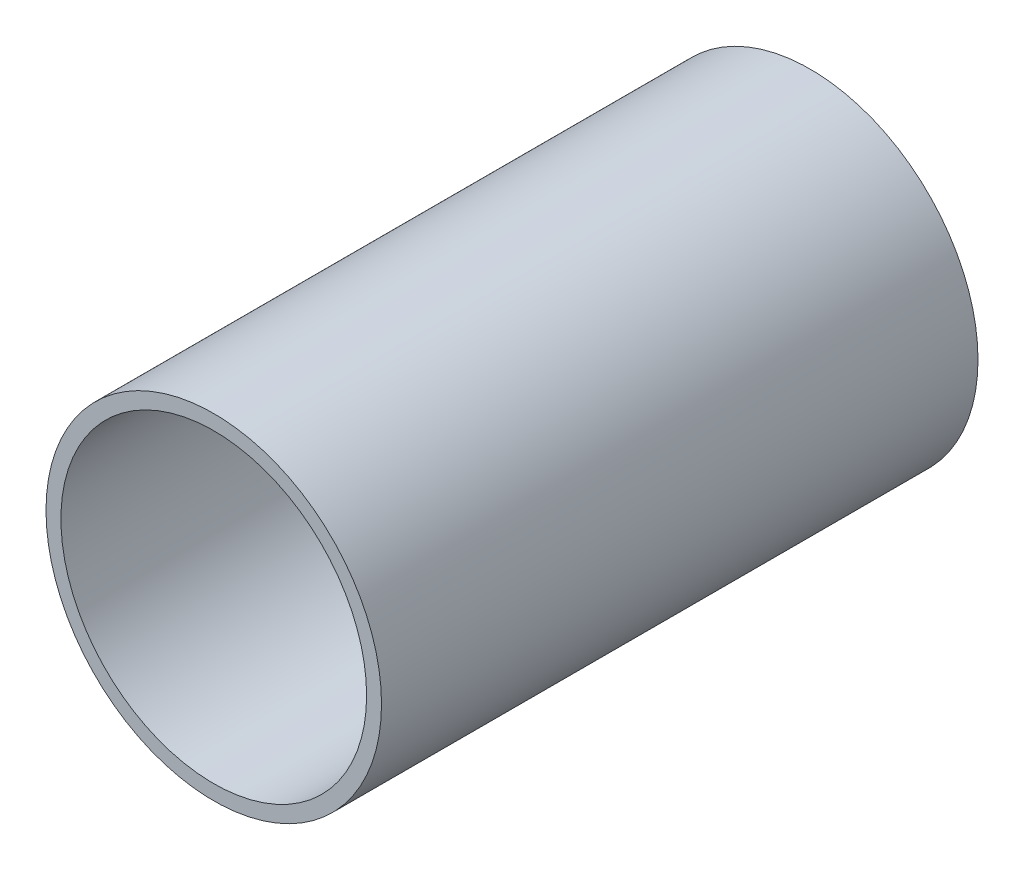
from build123d import *

# Parameters (mm, degrees)
SKETCH1_R           = 22.5
SKETCH1_R_2         = 20.5
BOSS_EXTRUDE1_DEPTH = 80


with BuildPart() as part:
    # Sketch1 → Boss-Extrude1 (new body)
    with BuildSketch(Plane.XY):
        Circle(SKETCH1_R)
        Circle(SKETCH1_R_2, mode=Mode.SUBTRACT)
    extrude(amount=BOSS_EXTRUDE1_DEPTH)


solid = part.part
